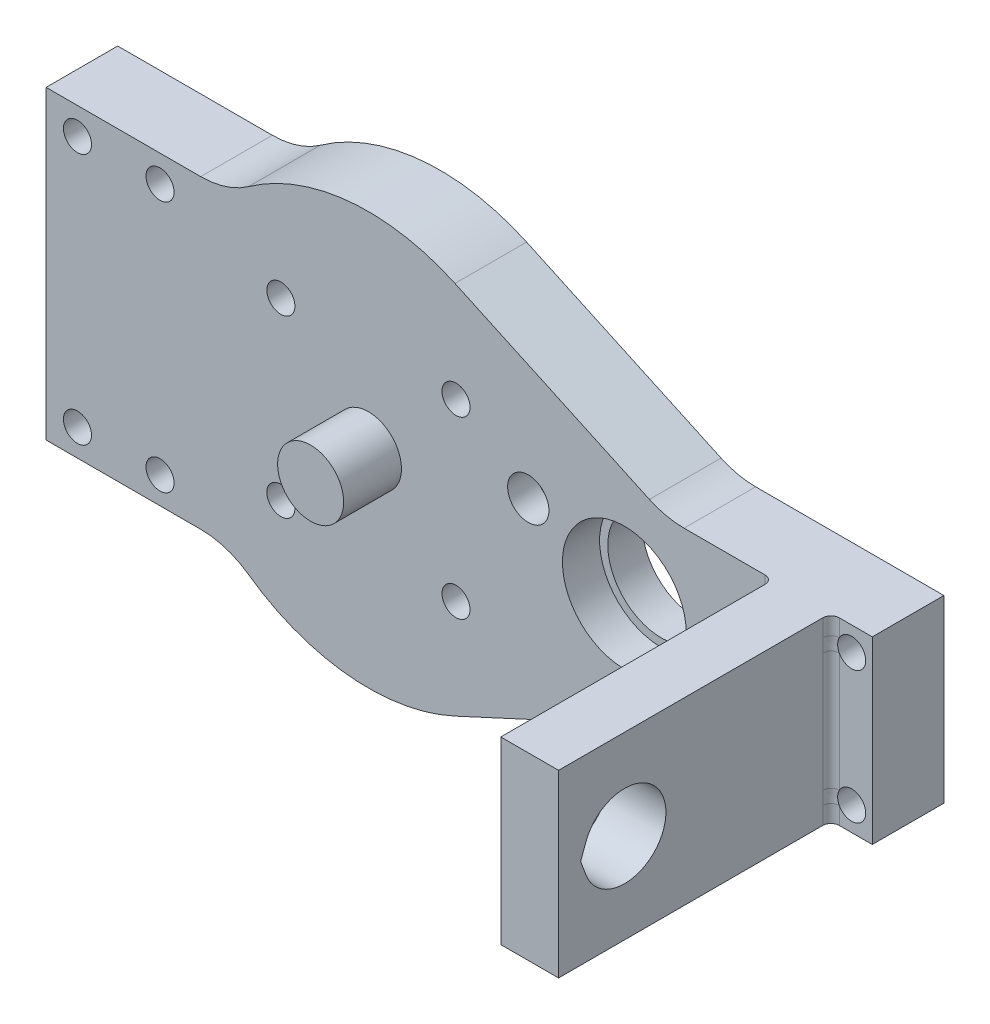
from build123d import *

# Parameters (mm, degrees)
BOSS_EXTRUDE1_DEPTH  = 4.5
SKETCH2_R            = 7.5
CUT_EXTRUDE1_DEPTH   = 50.942466899
SKETCH3_R            = 4
BOSS_EXTRUDE2_DEPTH  = 7
BOSS_EXTRUDE3_DEPTH  = 4.5
FILLET1_R            = 10
CUT_EXTRUDE4_DEPTH   = 62.754464971
SKETCH9_R            = 1
CUT_EXTRUDE5_DEPTH   = 62.182594482
SKETCH10_R           = 1.7
CUT_EXTRUDE6_DEPTH   = 2.4
CUT_EXTRUDE7_DEPTH   = 4.5
FILLET2_R            = 10
CUT_EXTRUDE8_DEPTH   = 51.658168147
SKETCH23_R           = 1
SKETCH23_R_2         = 6.5
BOSS_EXTRUDE6_DEPTH  = 4.175
BOSS_EXTRUDE7_START  = -8.675
BOSS_EXTRUDE7_DEPTH  = 8.675
SKETCH26_W           = 9
SKETCH26_H           = 21.787737724
BOSS_EXTRUDE8_DEPTH  = 33
CUT_EXTRUDE9_REACH   = 94.723
SKETCH27_R           = 5
BOSS_EXTRUDE9_DEPTH  = 8.675
BOSS_EXTRUDE10_DEPTH = 105
FILLET4_R            = 10
CUT_EXTRUDE10_DEPTH  = 9
SKETCH31_W           = 12
SKETCH31_H           = 25
CUT_EXTRUDE11_DEPTH  = 122.612556686
BOSS_EXTRUDE11_DEPTH = 10
CUT_EXTRUDE12_REACH  = 141.704
SKETCH33_W           = 10
SKETCH33_H           = 33
CUT_EXTRUDE13_REACH  = 155.593
SKETCH34_W           = 105
SKETCH34_H           = 35
SKETCH37_W           = 2
SKETCH37_H           = 21.787737724
CUT_EXTRUDE16_DEPTH  = 33
SKETCH38_R           = 1.5
CUT_EXTRUDE17_DEPTH  = 10
SKETCH39_R           = 2.5
CUT_EXTRUDE18_DEPTH  = 3.5
SKETCH40_W           = 23.687187028
SKETCH40_H           = 37
CUT_EXTRUDE19_DEPTH  = 133.5
SKETCH41_W           = 12
SKETCH41_H           = 25
BOSS_EXTRUDE12_DEPTH = 8.675
SKETCH42_W           = 11.686830052
SKETCH42_H           = 37
CUT_EXTRUDE20_DEPTH  = 70.667883159
SKETCH43_R           = 1
CUT_EXTRUDE21_DEPTH  = 70.667883159
SKETCH44_R           = 1.7
CUT_EXTRUDE22_DEPTH  = 3
SKETCH45_W           = 5
SKETCH45_H           = 21.787737724
SKETCH45_R           = 1
BOSS_EXTRUDE13_DEPTH = 8.675
SKETCH46_R           = 1.7
CUT_EXTRUDE23_DEPTH  = 3
FILLET5_R            = 1


with BuildPart() as part:
    # Sketch1 → Boss-Extrude1 (new body)
    with BuildSketch(Plane.XY):
        with BuildLine():
            Line((10.483870968, 22.695560128), (36.032258065, 10.893868862))
            ThreePointArc((36.032258065, 10.893868862), (43, 0), (36.032258065, -10.893868862))
            Line((36.032258065, -10.893868862), (10.483870968, -22.695560128))
            ThreePointArc((10.483870968, -22.695560128), (-25, 0), (10.483870968, 22.695560128))
        make_face()
    extrude(amount=BOSS_EXTRUDE1_DEPTH)

    # Sketch2 → Cut-Extrude1 (cut, through all)
    with BuildSketch(Plane.XY.offset(4.5)):
        with Locations((31, 0)):
            Circle(SKETCH2_R)
    extrude(amount=-CUT_EXTRUDE1_DEPTH, mode=Mode.SUBTRACT)

    # Sketch3 → Boss-Extrude2 (add)
    with BuildSketch(Plane.XY.offset(4.5)):
        Circle(SKETCH3_R)
    extrude(amount=BOSS_EXTRUDE2_DEPTH)

    # Sketch4 → Boss-Extrude3 (add)
    with BuildSketch(Plane(origin=(0, 0, 0), x_dir=(-1, 0, 0), z_dir=(0, 0, -1))):
        with BuildLine():
            Line((-36.032258065, 10.893868862), (-56.032258065, 10.893868862))
            Line((-56.032258065, 10.893868862), (-56.032258065, -10.893868862))
            Line((-56.032258065, -10.893868862), (-36.032258065, -10.893868862))
            ThreePointArc((-36.032258065, -10.893868862), (-43, 0), (-36.032258065, 10.893868862))
        make_face()
        with BuildLine():
            Line((22.501635968, 10.893868862), (42.501635968, 10.893868862))
            Line((42.501635968, 10.893868862), (42.501635968, -10.893868862))
            Line((42.501635968, -10.893868862), (22.501635968, -10.893868862))
            ThreePointArc((22.501635968, -10.893868862), (25, 0), (22.501635968, 10.893868862))
        make_face()
    extrude(amount=-BOSS_EXTRUDE3_DEPTH)

    # Fillet1
    fillet1_edges = [part.edges().sort_by_distance(p)[0] for p in [
        (56.032258065, 10.893868862, 2.25),
        (56.032258065, -10.893868862, 2.25),
        (-42.501635968, -10.893868862, 2.25),
        (-42.501635968, 10.893868862, 2.25),
    ]]
    fillet(fillet1_edges, radius=FILLET1_R)

    # Sketch8 → Cut-Extrude4 (cut, through all)
    with BuildSketch(Plane.XY.offset(4.5)):
        with BuildLine():
            Line((56.032258065, 0.893868862), (56.032258065, -0.893868862))
            ThreePointArc((56.032258065, -0.893868862), (55.873267798, -2.669967796), (55.401352579, -4.389590243))
            Line((55.401352579, -4.389590243), (55.401352579, 4.389590243))
            ThreePointArc((55.401352579, 4.389590243), (55.873267798, 2.669967796), (56.032258065, 0.893868862))
        make_face()
        with BuildLine():
            Line((-42.501635968, -0.893868862), (-42.501635968, 0.893868862))
            ThreePointArc((-42.501635968, 0.893868862), (-42.342645701, 2.669967796), (-41.870730482, 4.389590243))
            Line((-41.870730482, 4.389590243), (-41.870730482, -4.389590243))
            ThreePointArc((-41.870730482, -4.389590243), (-42.342645701, -2.669967796), (-42.501635968, -0.893868862))
        make_face()
    extrude(amount=-CUT_EXTRUDE4_DEPTH, mode=Mode.SUBTRACT)

    # Sketch9 → Cut-Extrude5 (cut, through all)
    with BuildSketch(Plane.XY.offset(4.5)):
        with Locations((-10.606601718, 10.606601718)):
            Circle(SKETCH9_R)
        with Locations((10.606601718, 10.606601718)):
            Circle(SKETCH9_R)
        with Locations((10.606601718, -10.606601718)):
            Circle(SKETCH9_R)
        with Locations((-10.606601718, -10.606601718)):
            Circle(SKETCH9_R)
    extrude(amount=-CUT_EXTRUDE5_DEPTH, mode=Mode.SUBTRACT)

    # Sketch10 → Cut-Extrude6 (cut)
    with BuildSketch(Plane.XY.offset(4.5)):
        with Locations((-10.606601718, 10.606601718)):
            Circle(SKETCH10_R)
        with Locations((10.606601718, 10.606601718)):
            Circle(SKETCH10_R)
        with Locations((10.606601718, -10.606601718)):
            Circle(SKETCH10_R)
        with Locations((-10.606601718, -10.606601718)):
            Circle(SKETCH10_R)
    extrude(amount=-CUT_EXTRUDE6_DEPTH, mode=Mode.SUBTRACT)

    # Sketch11 → Cut-Extrude7 (cut)
    with BuildSketch(Plane(origin=(0, 0, 0), x_dir=(-1, 0, 0), z_dir=(0, 0, -1))):
        with BuildLine():
            Line((-40.960235838, 14.646128502), (-73.67178465, 18.9155259))
            Line((-73.67178465, 18.9155259), (-68.640309048, -15.675868866))
            Line((-68.640309048, -15.675868866), (-41.444996676, -13.212200821))
            ThreePointArc((-41.444996676, -13.212200821), (-43.493415761, 0.756825882), (-40.960235838, 14.646128502))
        make_face()
    extrude(amount=-CUT_EXTRUDE7_DEPTH, mode=Mode.SUBTRACT)

    # Fillet2
    # the kernel refuses this fillet: 10 mm, written as the material it takes off along each edge
    with BuildSketch(Plane(origin=(42.113817462, -10.893868862, 28.001897109), x_dir=(0.1443560651040101, 0.9895258088941827, 0), z_dir=(0, 0, -1))) as fillet2_piece_1:
        with BuildLine():
            CenterArc((8.32021185, -9.941449502), FILLET2_R, 83.796810377, 73.10182949)
            Line((-0.877909984, -6.017859982), (-1.061872421, -5.939388192))
            ThreePointArc((-1.061872421, -5.939388192), (-0.636860154, -2.980058778), (-0.197905162, 0.028871213))
            Line((-0.197905162, 0.028871213), (-0.02161094, 0.19882899))
            ThreePointArc((-0.02161094, 0.19882899), (4.700379422, 0.454694668), (9.422369784, 0.19882899))
            Line((9.422369784, 0.19882899), (9.400758844, 0))
        make_face()
    extrude(amount=51.503794219, mode=Mode.SUBTRACT)
    with BuildSketch(Plane(origin=(42.113817462, 10.893868862, 28.001897109), x_dir=(-1, 0, 0), z_dir=(0, 0, -1))) as fillet2_piece_2:
        with BuildLine():
            CenterArc((8.636247816, -9.668172893), FILLET2_R, 104.801368002, 73.10182949)
            Line((-1.357056556, -9.302293499), (-1.556922643, -9.294975911))
            ThreePointArc((-1.556922643, -9.294975911), (-1.128460387, -4.585508816), (-0.193626747, 0.050086753))
            Line((-0.193626747, 0.050086753), (0, 0.2))
            ThreePointArc((0, 0.2), (3.040779699, 0.2), (6.030465629, 0.193363458))
            Line((6.030465629, 0.193363458), (6.081559398, 0))
        make_face()
    extrude(amount=51.503794219, mode=Mode.SUBTRACT)

    # Sketch12 → Cut-Extrude8 (cut, through all)
    with BuildSketch(Plane.XY.offset(4.5)):
        with BuildLine():
            Line((-22.501635968, 10.893868862), (-42.592674389, 14.819498464))
            Line((-42.592674389, 14.819498464), (-48.148078041, -13.612584929))
            Line((-48.148078041, -13.612584929), (-27.427309778, -14.315310761))
            Line((-27.427309778, -14.315310761), (-22.501635968, -10.893868862))
            ThreePointArc((-22.501635968, -10.893868862), (-25, 0), (-22.501635968, 10.893868862))
        make_face()
    extrude(amount=-CUT_EXTRUDE8_DEPTH, mode=Mode.SUBTRACT)

    # Sketch23 → Boss-Extrude6 (add)
    with BuildSketch(Plane(origin=(0, 0, 0), x_dir=(-1, 0, 0), z_dir=(0, 0, -1))):
        with BuildLine():
            Line((-36.032258065, -10.893868862), (-10.483870968, -22.695560128))
            ThreePointArc((-10.483870968, -22.695560128), (25, 0), (-10.483870968, 22.695560128))
            Line((-10.483870968, 22.695560128), (-36.032258065, 10.893868862))
            ThreePointArc((-36.032258065, 10.893868862), (-41.287575846, 7.470998455), (-43.470874018, 1.591575362))
            ThreePointArc((-43.470874018, 1.591575362), (-43.5, 0), (-43.470874018, -1.591575362))
            ThreePointArc((-43.470874018, -1.591575362), (-41.287575846, -7.470998455), (-36.032258065, -10.893868862))
        make_face()
        with Locations(Location((-10.606601718, -10.606601718, 0), (0, 0, 180))):
            Circle(SKETCH23_R, mode=Mode.SUBTRACT)
        with Locations(Location((10.606601718, -10.606601718, 0), (0, 0, 180))):
            Circle(SKETCH23_R, mode=Mode.SUBTRACT)
        with Locations(Location((10.606601718, 10.606601718, 0), (0, 0, 180))):
            Circle(SKETCH23_R, mode=Mode.SUBTRACT)
        with Locations(Location((-10.606601718, 10.606601718, 0), (0, 0, 180))):
            Circle(SKETCH23_R, mode=Mode.SUBTRACT)
        with Locations((-31, 0)):
            Circle(SKETCH23_R_2, mode=Mode.SUBTRACT)
    extrude(amount=BOSS_EXTRUDE6_DEPTH)

    # Sketch25 → Boss-Extrude7 (add)
    with BuildSketch(Plane(origin=(0, 0, -4.175), x_dir=(-1, 0, 0), z_dir=(0, 0, -1)).offset(BOSS_EXTRUDE7_START)):
        with BuildLine():
            Line((-36.032258065, 10.893868862), (-56.032258065, 10.893868862))
            Line((-56.032258065, 10.893868862), (-56.032258065, -10.893868862))
            Line((-56.032258065, -10.893868862), (-36.032258065, -10.893868862))
            ThreePointArc((-36.032258065, -10.893868862), (-41.287575846, -7.470998455), (-43.470874018, -1.591575362))
            ThreePointArc((-43.470874018, -1.591575362), (-43.5, 0), (-43.470874018, 1.591575362))
            ThreePointArc((-43.470874018, 1.591575362), (-41.287575846, 7.470998455), (-36.032258065, 10.893868862))
        make_face()
    extrude(amount=BOSS_EXTRUDE7_DEPTH)

    # Sketch26 → Boss-Extrude8 (add)
    with BuildSketch(Plane.XY.offset(4.5)):
        with Locations((51.532258065, 0)):
            Rectangle(SKETCH26_W, SKETCH26_H)
    extrude(amount=BOSS_EXTRUDE8_DEPTH)

    # Sketch27 → Cut-Extrude9 (cut, up to next)
    with BuildSketch(Plane(origin=(56.032258065, 0, 0), x_dir=(0, 0, -1), z_dir=(1, 0, 0)), mode=Mode.PRIVATE) as cut_extrude9_sk1:
        with Locations((-29.5, 0)):
            Circle(SKETCH27_R)
    cut_extrude9_tool1 = extrude(cut_extrude9_sk1.sketch, amount=-CUT_EXTRUDE9_REACH, mode=Mode.PRIVATE) & part.part
    add(cut_extrude9_tool1.solids().sort_by_distance((56.032258, 0, 29.5))[0], mode=Mode.SUBTRACT)

    # Sketch28 → Boss-Extrude9 (add)
    with BuildSketch(Plane(origin=(0, 0, -4.175), x_dir=(-1, 0, 0), z_dir=(0, 0, -1))):
        with BuildLine():
            Line((16.815171721, 18.5), (50.732139714, 18.5))
            Line((50.732139714, 18.5), (50.732139714, -18.5))
            Line((50.732139714, -18.5), (16.815171721, -18.5))
            ThreePointArc((16.815171721, -18.5), (25, 0), (16.815171721, 18.5))
        make_face()
    extrude(amount=-BOSS_EXTRUDE9_DEPTH)

    # Sketch29 → Boss-Extrude10 (add)
    with BuildSketch(Plane.XY.offset(4.5)):
        Polygon((-50.732139714, 18.5), (-33.773655718, 18.5), (-33.773655718, 16.5), (-48.732139714, 16.5), (-48.732139714, -16.5), (-33.773655718, -16.5), (-33.773655718, -18.5), (-50.732139714, -18.5), align=None)
    extrude(amount=BOSS_EXTRUDE10_DEPTH)

    # Fillet4
    fillet4_edges = [part.edges().sort_by_distance(p)[0] for p in [
        (-16.815171721, 18.5, 0.1625),
        (-16.815171721, -18.5, 0.1625),
        (36.032258065, 10.893868862, 0.1625),
        (36.032258065, -10.893868862, 0.1625),
    ]]
    fillet(fillet4_edges, radius=FILLET4_R)

    # Sketch30 → Cut-Extrude10 (cut)
    with BuildSketch(Plane(origin=(56.032258065, 0, 0), x_dir=(0, 0, -1), z_dir=(1, 0, 0))):
        with BuildLine():
            Line((-34.192833193, 1.725490257), (-34.827272241, 0))
            Line((-34.827272241, 0), (-34.192833193, -1.725490257))
            ThreePointArc((-34.192833193, -1.725490257), (-34.5, 0), (-34.192833193, 1.725490257))
        make_face()
    extrude(amount=-CUT_EXTRUDE10_DEPTH, mode=Mode.SUBTRACT)

    # Sketch31 → Cut-Extrude11 (cut, through all)
    with BuildSketch(Plane.XY.offset(4.5)):
        with Locations((-40.670586902, 0)):
            Rectangle(SKETCH31_W, SKETCH31_H)
    extrude(amount=-CUT_EXTRUDE11_DEPTH, mode=Mode.SUBTRACT)

    # Sketch32 → Boss-Extrude11 (add)
    with BuildSketch(Plane.XY.offset(4.5)):
        Polygon((-33.773655718, 18.5), (-33.773655718, 16.5), (-27.732139714, 16.5), (-27.732139714, -16.5), (-33.773655718, -16.5), (-33.773655718, -18.5), (-27.044952686, -18.5), (-27.044952686, 18.5), align=None)
    extrude(amount=BOSS_EXTRUDE11_DEPTH)

    # Sketch33 → Cut-Extrude12 (cut, up to next)
    with BuildSketch(Plane(origin=(-27.044952686, 0, 0), x_dir=(0, 0, -1), z_dir=(1, 0, 0)), mode=Mode.PRIVATE) as cut_extrude12_sk1:
        with Locations((-9.5, 0)):
            Rectangle(SKETCH33_W, SKETCH33_H)
    cut_extrude12_tool1 = extrude(cut_extrude12_sk1.sketch, amount=-CUT_EXTRUDE12_REACH, mode=Mode.PRIVATE) & part.part
    add(cut_extrude12_tool1.solids().sort_by_distance((-27.044953, 0, 9.5))[0], mode=Mode.SUBTRACT)

    # Cut-Extrude13: up to this face of the body (flat: up to its plane)
    cut_extrude13_end = Plane(part.part.faces().sort_by_distance((-27.044952686, -17.5, 9.5))[0])
    # Sketch34 → Cut-Extrude13 (cut, up to the picked face)
    with BuildSketch(Plane(origin=(-48.732139714, 0, 0), x_dir=(0, 0, -1), z_dir=(1, 0, 0)), mode=Mode.PRIVATE) as cut_extrude13_sk1:
        with Locations((-57, 0)):
            Rectangle(SKETCH34_W, SKETCH34_H)
    cut_extrude13_tool1 = split(extrude(cut_extrude13_sk1.sketch, amount=CUT_EXTRUDE13_REACH, mode=Mode.PRIVATE), bisect_by=cut_extrude13_end, keep=Keep.BOTH, mode=Mode.PRIVATE)
    add(cut_extrude13_tool1.solids().sort_by(Axis((-48.73214, 0, 57), (1, 0, 0)))[0], mode=Mode.SUBTRACT)

    # Sketch37 → Cut-Extrude16 (cut)
    with BuildSketch(Plane.XY.offset(37.5)):
        with Locations((48.032258065, 0)):
            Rectangle(SKETCH37_W, SKETCH37_H)
    extrude(amount=-CUT_EXTRUDE16_DEPTH, mode=Mode.SUBTRACT)

    # Sketch38 → Cut-Extrude17 (cut)
    with BuildSketch(Plane.XY.offset(4.5)):
        with Locations((19.360446706, 4.557499217)):
            Circle(SKETCH38_R)
        with Locations((42.639553294, -4.557499217)):
            Circle(SKETCH38_R)
    extrude(amount=-CUT_EXTRUDE17_DEPTH, mode=Mode.SUBTRACT)

    # Sketch39 → Cut-Extrude18 (cut)
    with BuildSketch(Plane.XY.offset(4.5)):
        with Locations((19.360446706, 4.557499217)):
            Circle(SKETCH39_R)
        with Locations((42.639553294, -4.557499217)):
            Circle(SKETCH39_R)
    extrude(amount=-CUT_EXTRUDE18_DEPTH, mode=Mode.SUBTRACT)

    # Sketch40 → Cut-Extrude19 (cut)
    with BuildSketch(Plane.XY.offset(4.5)):
        with Locations((-38.8885462, 0)):
            Rectangle(SKETCH40_W, SKETCH40_H)
    extrude(amount=CUT_EXTRUDE19_DEPTH, mode=Mode.SUBTRACT)

    # Sketch41 → Boss-Extrude12 (add)
    with BuildSketch(Plane.XY.offset(4.5)):
        with Locations((-40.670586902, 0)):
            Rectangle(SKETCH41_W, SKETCH41_H)
    extrude(amount=-BOSS_EXTRUDE12_DEPTH)

    # Sketch42 → Cut-Extrude20 (cut, through all)
    with BuildSketch(Plane.XY.offset(4.5)):
        with Locations((-44.888724688, 0)):
            Rectangle(SKETCH42_W, SKETCH42_H)
    extrude(amount=-CUT_EXTRUDE20_DEPTH, mode=Mode.SUBTRACT)

    # Sketch43 → Cut-Extrude21 (cut, through all)
    with BuildSketch(Plane.XY.offset(4.5)):
        with Locations((-35.245309662, 15.250384638)):
            Circle(SKETCH43_R)
        with Locations((-35.245309662, -15.250384638)):
            Circle(SKETCH43_R)
        with Locations((-25.245309662, 15.250384638)):
            Circle(SKETCH43_R)
        with Locations((-25.245309662, -15.250384638)):
            Circle(SKETCH43_R)
    extrude(amount=-CUT_EXTRUDE21_DEPTH, mode=Mode.SUBTRACT)

    # Sketch44 → Cut-Extrude22 (cut)
    with BuildSketch(Plane.XY.offset(4.5)):
        with Locations((-35.245309662, 15.250384638)):
            Circle(SKETCH44_R)
        with Locations((-25.245309662, 15.250384638)):
            Circle(SKETCH44_R)
        with Locations((-35.245309662, -15.250384638)):
            Circle(SKETCH44_R)
        with Locations((-25.245309662, -15.250384638)):
            Circle(SKETCH44_R)
    extrude(amount=-CUT_EXTRUDE22_DEPTH, mode=Mode.SUBTRACT)

    # Sketch45 → Boss-Extrude13 (add)
    with BuildSketch(Plane(origin=(0, 0, -4.175), x_dir=(-1, 0, 0), z_dir=(0, 0, -1))):
        with Locations((-58.532258065, 0)):
            Rectangle(SKETCH45_W, SKETCH45_H)
        with Locations((-58.532258065, 8)):
            Circle(SKETCH45_R, mode=Mode.SUBTRACT)
        with Locations((-58.532258065, -8)):
            Circle(SKETCH45_R, mode=Mode.SUBTRACT)
    extrude(amount=-BOSS_EXTRUDE13_DEPTH)

    # Sketch46 → Cut-Extrude23 (cut)
    with BuildSketch(Plane.XY.offset(4.5)):
        with Locations((58.532258065, 8)):
            Circle(SKETCH46_R)
        with Locations((58.532258065, -8)):
            Circle(SKETCH46_R)
    extrude(amount=-CUT_EXTRUDE23_DEPTH, mode=Mode.SUBTRACT)

    # Fillet5
    fillet5_edges = [part.edges().sort_by_distance(p)[0] for p in [
        (49.032258065, 0, 4.5),
        (56.032258065, 0, 4.5),
    ]]
    fillet(fillet5_edges, radius=FILLET5_R)


solid = part.part
